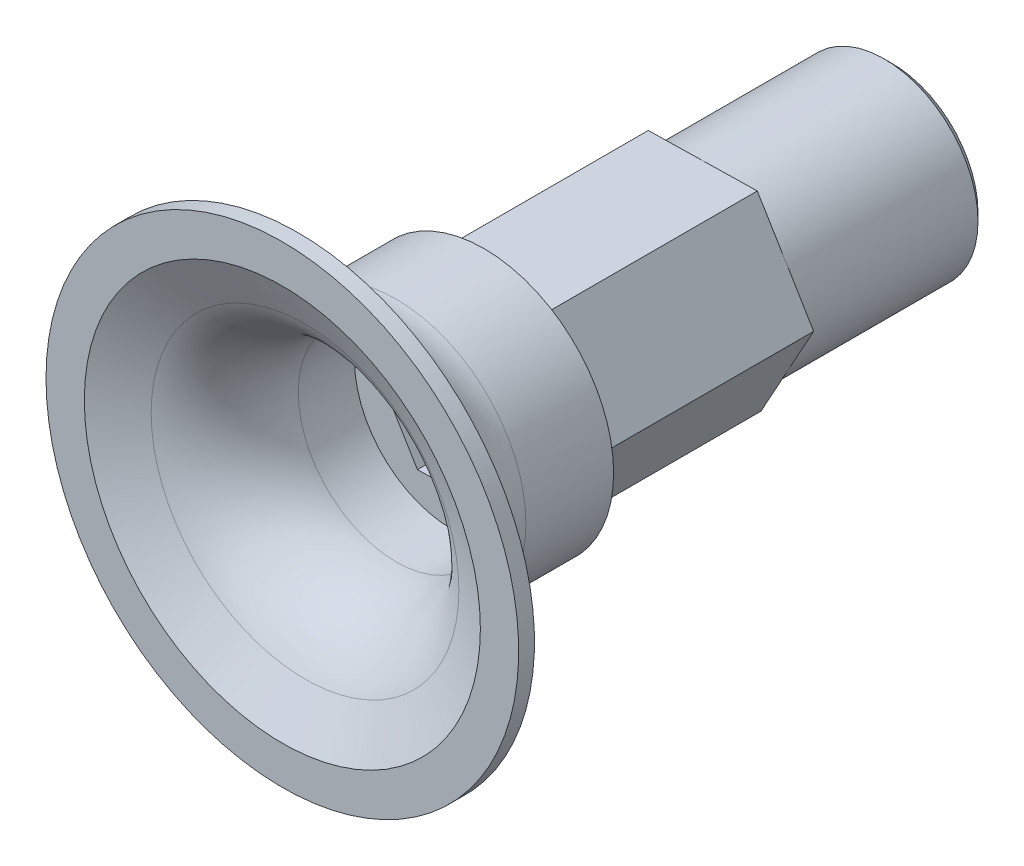
from build123d import *

# Parameters (mm, degrees)
SKETCH1_R           = 5.95
BOSS_EXTRUDE1_DEPTH = 11.9
M6_TAPPED_HOLE1_D   = 5
BOSS_EXTRUDE2_DEPTH = 14
CHAMFER1_SIZE       = 0.5
SHELL1_START        = 13.9
SHELL1_DEPTH        = 24.8
SHELL1_START_2      = 27.9
SHELL1_2_OUTLINE_R  = 6.224211325
SHELL1_2_DEPTH      = 10.8
SKETCH6_R           = 2.5
CUT_EXTRUDE1_DEPTH  = 35.179526035


with BuildPart() as part:
    # Sketch1 → Boss-Extrude1 (new body)
    with BuildSketch(Plane.XY):
        Circle(SKETCH1_R)
    extrude(amount=BOSS_EXTRUDE1_DEPTH)

    # M6 Tapped Hole1 (through all)
    with Locations(Plane(origin=(0, 0, 0), x_dir=(-1, 0, 0), z_dir=(0, 0, -1))):
        with Locations((0, 0)):
            Hole(M6_TAPPED_HOLE1_D / 2)

    # Sketch4 → Boss-Extrude2 (add)
    with BuildSketch(Plane.XY.offset(11.9)):
        Polygon((6.921331173, 0.134625435), (3.34407654, 6.061361341), (-3.577254633, 5.926735906), (-6.921331173, -0.134625435), (-3.34407654, -6.061361341), (3.577254633, -5.926735906), align=None)
    extrude(amount=BOSS_EXTRUDE2_DEPTH)

    # Sketch5 → Revolve1 (revolve)
    with BuildSketch(Plane(origin=(0, 0, 0), x_dir=(1, 0, 0), z_dir=(0, 1, 0))):
        with BuildLine():
            Line((-6.921331173, -25.9), (-8.224211325, -25.9))
            Line((-8.224211325, -25.9), (-8.224211325, -31.466244152))
            ThreePointArc((-8.224211325, -31.466244152), (-8.886011508, -33.819165828), (-10.677341595, -35.48210191))
            Line((-10.677341595, -35.48210191), (-15, -37.7))
            Line((-15, -37.7), (-15, -38.7))
            Line((-15, -38.7), (0, -38.7))
            Line((0, -38.7), (0, -25.9))
            Line((0, -25.9), (-6.921331173, -25.9))
        make_face()
    revolve(axis=Axis((0, 0, 0), (0, 0, 1)))

    # Chamfer1
    chamfer1_edges = [part.edges().sort_by_distance(p)[0] for p in [
        (-5.95, 0, 0),
    ]]
    chamfer(chamfer1_edges, length=CHAMFER1_SIZE)

    # Shell1: read off the stored shape, not the designer's step
    # Shell1 outline → Shell1 (cut)
    with BuildSketch(Plane.XY.offset(SHELL1_START)):
        Polygon((-2.228488616, -4.039283965), (2.383878219, -3.949569736), (4.612366834, 0.089714229), (2.228488616, 4.039283965), (-2.383878219, 3.949569736), (-4.612366834, -0.089714229), align=None)
    extrude(amount=SHELL1_DEPTH, mode=Mode.SUBTRACT)

    # Shell1 2 outline → Shell1 2 (cut)
    with BuildSketch(Plane.XY.offset(SHELL1_START_2)):
        Circle(SHELL1_2_OUTLINE_R)
        Polygon((4.612366834, 0.089714229), (2.383878219, -3.949569736), (-2.228488616, -4.039283965), (-4.612366834, -0.089714229), (-2.383878219, 3.949569736), (2.228488616, 4.039283965), align=None, mode=Mode.SUBTRACT)
    extrude(amount=SHELL1_2_DEPTH, mode=Mode.SUBTRACT)

    # Shell1 3 outline → Shell1 3 (revolve, cut)
    with BuildSketch(Plane.XZ):
        with BuildLine():
            ThreePointArc((6.224211325, 31.466244152), (7.179257815, 34.861754834), (9.764333429, 37.261544544))
            Line((9.764333429, 37.261544544), (12.567866916, 38.7))
            Line((12.567866916, 38.7), (6.224211325, 38.7))
            Line((6.224211325, 38.7), (6.224211325, 31.466244152))
        make_face()
    revolve(axis=Axis((0, 0, 0), (0, 0, 1)), mode=Mode.SUBTRACT)

    # Sketch6 → Cut-Extrude1 (cut, through all)
    with BuildSketch(Plane(origin=(0, 0, 11.9), x_dir=(-1, 0, 0), z_dir=(0, 0, -1))):
        Circle(SKETCH6_R)
    extrude(amount=-CUT_EXTRUDE1_DEPTH, mode=Mode.SUBTRACT)


solid = part.part
